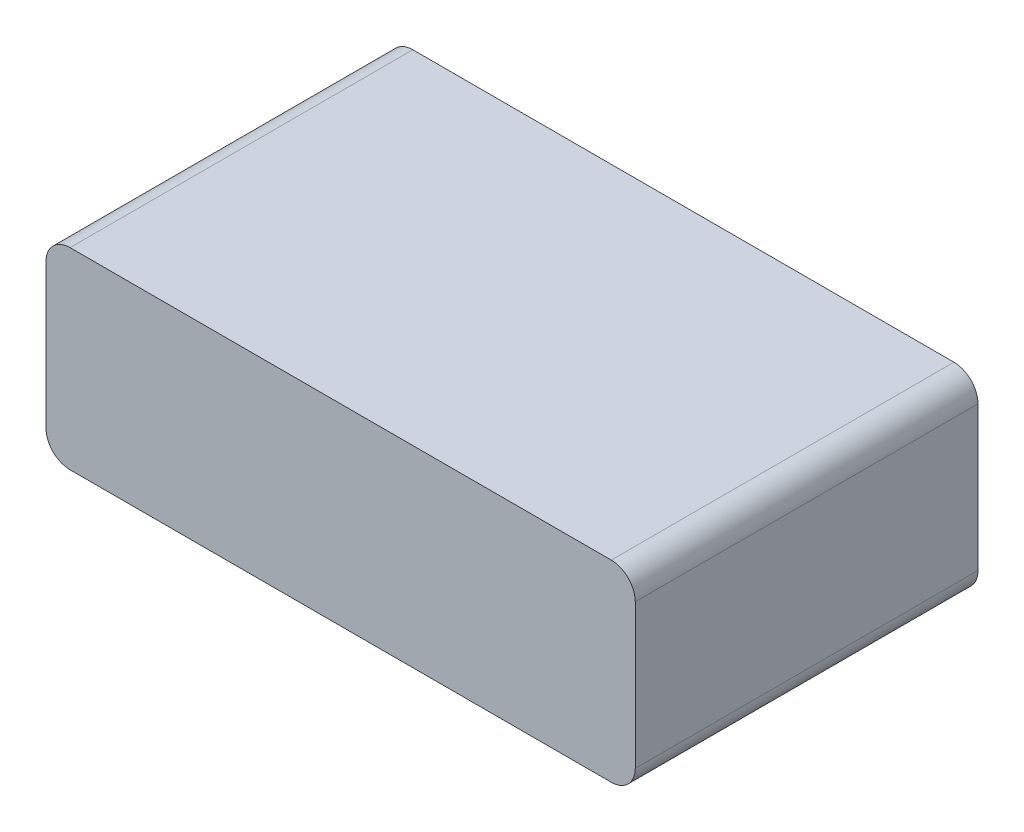
from build123d import *

# Parameters (mm, degrees)
SKETCH1_W           = 49
SKETCH1_H           = 28.5
BOSS_EXTRUDE1_DEPTH = 16
FILLET1_R           = 2


with BuildPart() as part:
    # Sketch1 → Boss-Extrude1 (new body)
    with BuildSketch(Plane(origin=(0, 0, 0), x_dir=(1, 0, 0), z_dir=(0, 1, 0))):
        with Locations((24.5, 14.25)):
            Rectangle(SKETCH1_W, SKETCH1_H)
    extrude(amount=BOSS_EXTRUDE1_DEPTH)

    # Fillet1
    fillet1_edges = [part.edges().sort_by_distance(p)[0] for p in [
        (49, 0, -14.25),
        (49, 16, -14.25),
        (0, 0, -14.25),
        (0, 16, -14.25),
    ]]
    fillet(fillet1_edges, radius=FILLET1_R)


solid = part.part
